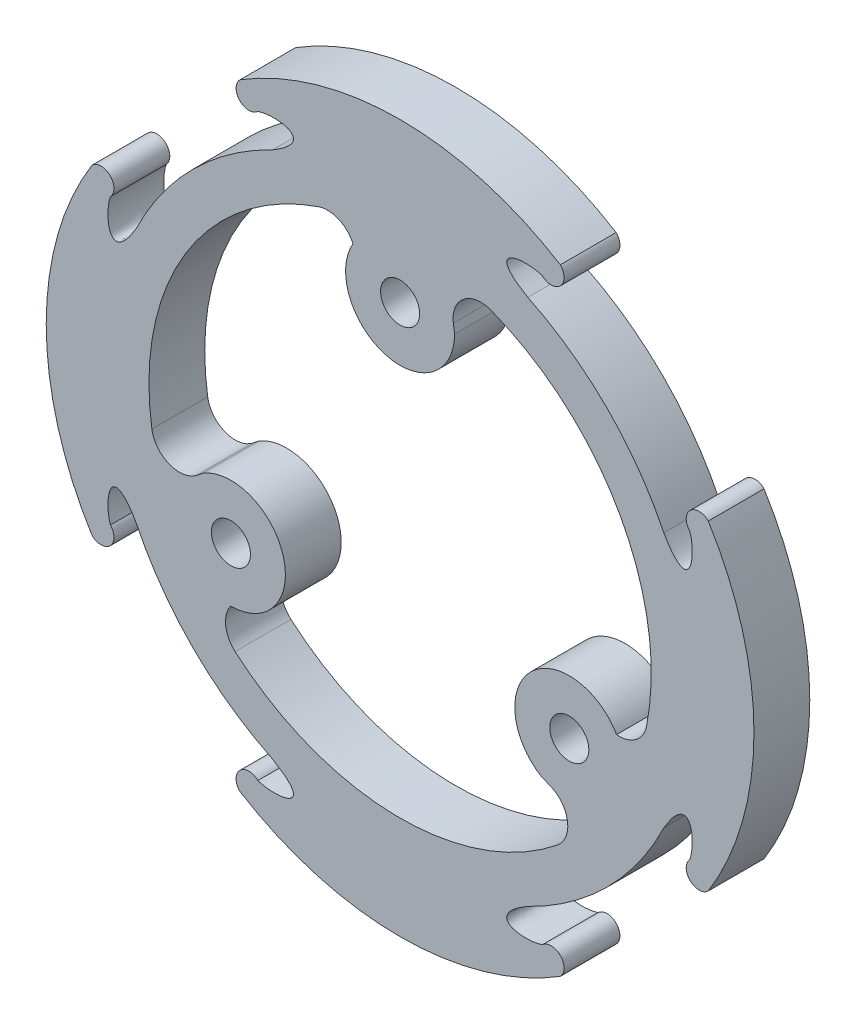
from build123d import *

# Parameters (mm, degrees)
SKETCH1_R           = 1.778
BOSS_EXTRUDE1_DEPTH = 2.54
FILLET1_R           = 2.54


with BuildPart() as part:
    # Sketch1 → Boss-Extrude1 (new, symmetric)
    with BuildSketch(Plane.XY):
        with BuildLine():
            ThreePointArc((23.096897519, 13.335), (18.163878776, 19.528502447), (11.629866574, 24.000731311))
            add(Edge.make_bspline(
                [(12.942718979, 26.367649013), (12.489890773, 26.524403161), (10.214611, 26.823602727), (8.514999239, 25.805149786), (11.629866574, 24.000731311)],
                knots=[0.119187678, 0.119187678, 0.119187678, 0.119187678, 0.354139338, 1, 1, 1, 1], degree=3))
            ThreePointArc((12.942718979, 26.367649013), (14.594299506, 26.395047723), (14.579783558, 28.046791715))
            ThreePointArc((14.579783558, 28.046791715), (0, 32.207688222), (-14.579783558, 28.046791715))
            ThreePointArc((-14.579783558, 28.046791715), (-14.594299506, 26.395047723), (-12.942718979, 26.367649013))
            add(Edge.make_bspline(
                [(-12.942718979, 26.367649013), (-12.489890773, 26.524403161), (-10.214611, 26.823602727), (-8.514999239, 25.805149786), (-11.629866574, 24.000731311)],
                knots=[0.119187678, 0.119187678, 0.119187678, 0.119187678, 0.354139338, 1, 1, 1, 1], degree=3))
            ThreePointArc((-11.629866574, 24.000731311), (-18.163878776, 19.528502447), (-23.096897519, 13.335))
            ThreePointArc((-23.096897519, 13.335), (-23.564242622, 12.49061126), (-24.000731311, 11.629866574))
            add(Edge.make_bspline(
                [(-26.367649013, 12.942718979), (-26.524403161, 12.489890773), (-26.823602727, 10.214611), (-25.805149786, 8.514999239), (-24.000731311, 11.629866574)],
                knots=[0.119187678, 0.119187678, 0.119187678, 0.119187678, 0.354139338, 1, 1, 1, 1], degree=3))
            ThreePointArc((-26.367649013, 12.942718979), (-26.395047723, 14.594299506), (-28.046791715, 14.579783558))
            ThreePointArc((-28.046791715, 14.579783558), (-32.207688222, 0), (-28.046791715, -14.579783558))
            ThreePointArc((-28.046791715, -14.579783558), (-26.395047723, -14.594299506), (-26.367649013, -12.942718979))
            add(Edge.make_bspline(
                [(-26.367649013, -12.942718979), (-26.524403161, -12.489890773), (-26.823602727, -10.214611), (-25.805149786, -8.514999239), (-24.000731311, -11.629866574)],
                knots=[0.119187678, 0.119187678, 0.119187678, 0.119187678, 0.354139338, 1, 1, 1, 1], degree=3))
            ThreePointArc((-24.000731311, -11.629866574), (-18.858537854, -18.858537854), (-11.629866574, -24.000731311))
            add(Edge.make_bspline(
                [(-12.942718979, -26.367649013), (-12.489890773, -26.524403161), (-10.214611, -26.823602727), (-8.514999239, -25.805149786), (-11.629866574, -24.000731311)],
                knots=[0.119187678, 0.119187678, 0.119187678, 0.119187678, 0.354139338, 1, 1, 1, 1], degree=3))
            ThreePointArc((-12.942718979, -26.367649013), (-14.594299506, -26.395047723), (-14.579783558, -28.046791715))
            ThreePointArc((-14.579783558, -28.046791715), (0, -32.207688222), (14.579783558, -28.046791715))
            ThreePointArc((14.579783558, -28.046791715), (14.594299506, -26.395047723), (12.942718979, -26.367649013))
            add(Edge.make_bspline(
                [(12.942718979, -26.367649013), (12.489890773, -26.524403161), (10.214611, -26.823602727), (8.514999239, -25.805149786), (11.629866574, -24.000731311)],
                knots=[0.119187678, 0.119187678, 0.119187678, 0.119187678, 0.354139338, 1, 1, 1, 1], degree=3))
            ThreePointArc((11.629866574, -24.000731311), (18.858537854, -18.858537854), (24.000731311, -11.629866574))
            add(Edge.make_bspline(
                [(26.367649013, -12.942718979), (26.524403161, -12.489890773), (26.823602727, -10.214611), (25.805149786, -8.514999239), (24.000731311, -11.629866574)],
                knots=[0.119187678, 0.119187678, 0.119187678, 0.119187678, 0.354139338, 1, 1, 1, 1], degree=3))
            ThreePointArc((26.367649013, -12.942718979), (26.395047723, -14.594299506), (28.046791715, -14.579783558))
            ThreePointArc((28.046791715, -14.579783558), (32.207688222, 0), (28.046791715, 14.579783558))
            ThreePointArc((28.046791715, 14.579783558), (26.395047723, 14.594299506), (26.367649013, 12.942718979))
            add(Edge.make_bspline(
                [(26.367649013, 12.942718979), (26.524403161, 12.489890773), (26.823602727, 10.214611), (25.805149786, 8.514999239), (24.000731311, 11.629866574)],
                knots=[0.119187678, 0.119187678, 0.119187678, 0.119187678, 0.354139338, 1, 1, 1, 1], degree=3))
            ThreePointArc((24.000731311, 11.629866574), (23.564242622, 12.49061126), (23.096897519, 13.335))
        make_face()
        with Locations((0, 17.78)):
            Circle(SKETCH1_R, mode=Mode.SUBTRACT)
        with Locations((15.397931679, -8.89)):
            Circle(SKETCH1_R, mode=Mode.SUBTRACT)
        with Locations((-15.397931679, -8.89)):
            Circle(SKETCH1_R, mode=Mode.SUBTRACT)
        with BuildLine():
            Line((-4.28625, 20.274952091), (-4.28625, 22.454568821))
            ThreePointArc((-4.28625, 22.454568821), (-13.24349331, 18.633021359), (-19.797340731, 11.43))
            ThreePointArc((-19.797340731, 11.43), (-22.758416501, 2.152690962), (-21.58935203, -7.515283024))
            Line((-21.58935203, -7.515283024), (-17.877685951, -4.59493961))
            ThreePointArc((-17.877685951, -4.59493961), (-10.605148477, -7.614870918), (-15.415498572, -13.849477433))
            Line((-15.415498572, -13.849477433), (-17.30310203, -14.939285797))
            ThreePointArc((-17.30310203, -14.939285797), (-9.514923191, -20.78571232), (0, -22.86))
            ThreePointArc((0, -22.86), (9.514923191, -20.78571232), (17.30310203, -14.939285797))
            Line((17.30310203, -14.939285797), (12.918177407, -13.18506039))
            ThreePointArc((12.918177407, -13.18506039), (11.8972459, -5.376892533), (19.701748572, -6.425474659))
            Line((19.701748572, -6.425474659), (21.58935203, -7.515283024))
            ThreePointArc((21.58935203, -7.515283024), (22.758416501, 2.152690962), (19.797340731, 11.43))
            ThreePointArc((19.797340731, 11.43), (13.24349331, 18.633021359), (4.28625, 22.454568821))
            Line((4.28625, 22.454568821), (4.959508544, 17.78))
            ThreePointArc((4.959508544, 17.78), (-1.292097423, 12.991763451), (-4.28625, 20.274952091))
        make_face(mode=Mode.SUBTRACT)
    extrude(amount=BOSS_EXTRUDE1_DEPTH, both=True)

    # Fillet1
    # the kernel refuses this fillet: 2.54 mm, written as the material it adds along each edge
    with BuildSketch(Plane(origin=(21.58935203, -7.515283024, 0), x_dir=(-0.8660254037844372, 0.5000000000000026, 0), z_dir=(0, 0, -1)), Plane(origin=(-17.30310203, -14.939285797, 0), x_dir=(0.8660254037844382, 0.5000000000000008, 0), z_dir=(0, 0, -1)), Plane(origin=(-4.28625, 22.454568821, 0), x_dir=(0, -1, 0), z_dir=(0, 0, -1))) as fillet1_piece_1:
        with BuildLine():
            CenterArc((3.235105636, 2.310312353), FILLET1_R, 161.0565991, 84.38964425)
            Line((0.832672738, 3.134882647), (0.78462408, 3.151374053))
            ThreePointArc((0.78462408, 3.151374053), (0.311567983, 1.595269408), (-0.049899042, 0.009525))
            Line((-0.049899042, 0.009525), (0, -0.0508))
            ThreePointArc((0, -0.0508), (1.089808365, -0.0508), (2.158506952, -0.046206247))
            Line((2.158506952, -0.046206247), (2.17961673, 0))
        make_face()
    extrude(amount=2.54)
    with BuildSketch(Plane(origin=(17.30310203, -14.939285797, 0), x_dir=(-0.7195709341275718, -0.6944189447003685, 0), z_dir=(0, 0, -1)), Plane(origin=(4.28625, 22.454568821, 0), x_dir=(0.9611699140434871, -0.2759572364291899, 0), z_dir=(0, 0, -1)), Plane(origin=(-21.58935203, -7.515283024, 0), x_dir=(-0.24159897991591575, 0.9703761811295601, 0), z_dir=(0, 0, -1))) as fillet1_piece_2:
        with BuildLine():
            CenterArc((3.922629513, 2.529497521), FILLET1_R, 155.785220789, 119.426923656)
            Line((1.60611307, 3.571299597), (1.559782741, 3.592135639))
            Line((1.559782741, 3.592135639), (-0.046330329, 0.020836042))
            Line((-0.046330329, 0.020836042), (-0.004614858, -0.05058995))
            ThreePointArc((-0.004614858, -0.05058995), (2.076686213, -0.145322312), (4.157987284, -0.05058995))
            Line((4.157987284, -0.05058995), (4.153372426, 0))
        make_face()
    extrude(amount=2.54)
    with BuildSketch(Plane(origin=(-21.58935203, -7.515283024, 0), x_dir=(-0.24159897991591575, 0.9703761811295601, 0), z_dir=(0, 0, 1)), Plane(origin=(4.28625, 22.454568821, 0), x_dir=(0.9611699140434871, -0.2759572364291899, 0), z_dir=(0, 0, 1)), Plane(origin=(17.30310203, -14.939285797, 0), x_dir=(-0.7195709341275718, -0.6944189447003685, 0), z_dir=(0, 0, 1))) as fillet1_piece_3:
        with BuildLine():
            CenterArc((3.922629513, -2.529497521), FILLET1_R, 84.787855555, 119.426923656)
            Line((1.60611307, -3.571299597), (1.559782741, -3.592135639))
            Line((1.559782741, -3.592135639), (-0.046330329, -0.020836042))
            Line((-0.046330329, -0.020836042), (-0.004614858, 0.05058995))
            ThreePointArc((-0.004614858, 0.05058995), (2.076686213, 0.145322312), (4.157987284, 0.05058995))
            Line((4.157987284, 0.05058995), (4.153372426, 0))
        make_face()
    extrude(amount=2.54)
    with BuildSketch(Plane(origin=(-4.28625, 22.454568821, 0), x_dir=(0, -1, 0), z_dir=(0, 0, 1)), Plane(origin=(-17.30310203, -14.939285797, 0), x_dir=(0.8660254037844382, 0.5000000000000008, 0), z_dir=(0, 0, 1)), Plane(origin=(21.58935203, -7.515283024, 0), x_dir=(-0.8660254037844372, 0.5000000000000026, 0), z_dir=(0, 0, 1))) as fillet1_piece_4:
        with BuildLine():
            CenterArc((3.235105636, -2.310312353), FILLET1_R, 114.55375665, 84.38964425)
            Line((0.832672738, -3.134882647), (0.78462408, -3.151374053))
            ThreePointArc((0.78462408, -3.151374053), (0.311567983, -1.595269408), (-0.049899042, -0.009525))
            Line((-0.049899042, -0.009525), (0, 0.0508))
            ThreePointArc((0, 0.0508), (1.089808365, 0.0508), (2.158506952, 0.046206247))
            Line((2.158506952, 0.046206247), (2.17961673, 0))
        make_face()
    extrude(amount=2.54)


solid = part.part
